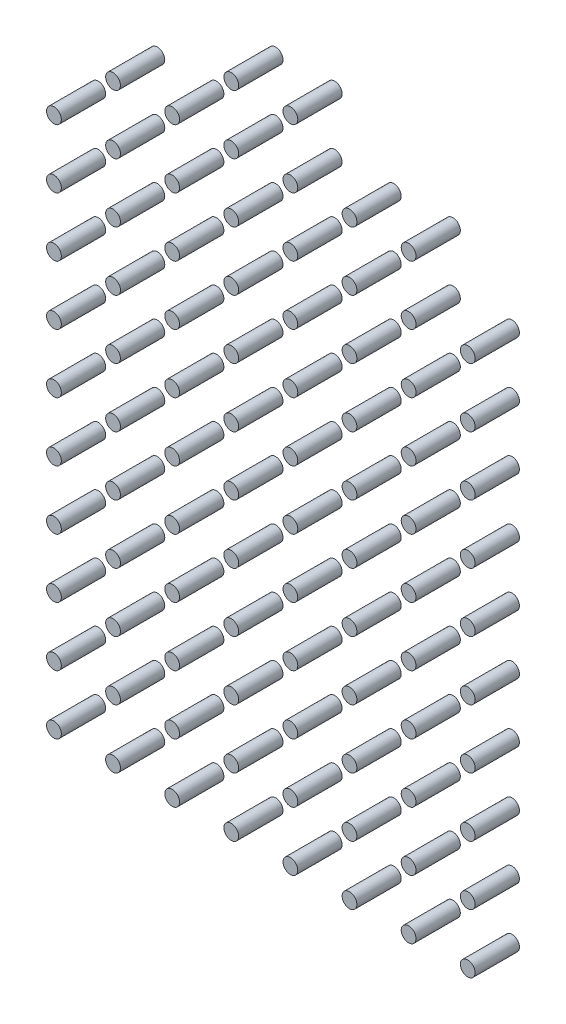
from build123d import *

# Parameters (mm, degrees)
SKETCH_2_R               = 0.25
EXTRUDE_2_DEPTH          = 1.5
PATTERN_LINEAR_1_COUNT   = 8
PATTERN_LINEAR_1_PITCH   = 2
PATTERN_LINEAR_1_2_COUNT = 8
PATTERN_LINEAR_1_2_PITCH = 2


with BuildPart() as part:
    # 草图2 → 凸台-拉伸2 (new body)
    with BuildSketch(Plane.XY):
        with Locations((-9.975090359, 7.0637984)):
            Circle(SKETCH_2_R)
    extrude(amount=EXTRUDE_2_DEPTH)


with BuildPart() as pattern_linear_1_1:
    # 阵列(线性)1: pattern copy
    add(part.part.moved(Location(Vector(1, 0, 0) * (1 * PATTERN_LINEAR_1_PITCH))))


with BuildPart() as pattern_linear_1_2:
    # 阵列(线性)1: pattern copy
    add(part.part.moved(Location(Vector(1, 0, 0) * (2 * PATTERN_LINEAR_1_PITCH))))


with BuildPart() as pattern_linear_1_3:
    # 阵列(线性)1: pattern copy
    add(part.part.moved(Location(Vector(1, 0, 0) * (3 * PATTERN_LINEAR_1_PITCH))))


with BuildPart() as pattern_linear_1_4:
    # 阵列(线性)1: pattern copy
    add(part.part.moved(Location(Vector(1, 0, 0) * (4 * PATTERN_LINEAR_1_PITCH))))


with BuildPart() as pattern_linear_1_5:
    # 阵列(线性)1: pattern copy
    add(part.part.moved(Location(Vector(1, 0, 0) * (5 * PATTERN_LINEAR_1_PITCH))))


with BuildPart() as pattern_linear_1_6:
    # 阵列(线性)1: pattern copy
    add(part.part.moved(Location(Vector(1, 0, 0) * (6 * PATTERN_LINEAR_1_PITCH))))


with BuildPart() as pattern_linear_1_7:
    # 阵列(线性)1: pattern copy
    add(part.part.moved(Location(Vector(1, 0, 0) * (7 * PATTERN_LINEAR_1_PITCH))))


with BuildPart() as pattern_linear_1_2_1:
    # Pattern Linear 1 2: pattern copy
    add(part.part.moved(Location(Vector(0, -1, 0) * (1 * PATTERN_LINEAR_1_2_PITCH))))


with BuildPart() as pattern_linear_1_2_2:
    # Pattern Linear 1 2: pattern copy
    add(part.part.moved(Location(Vector(0, -1, 0) * (2 * PATTERN_LINEAR_1_2_PITCH))))


with BuildPart() as pattern_linear_1_2_3:
    # Pattern Linear 1 2: pattern copy
    add(part.part.moved(Location(Vector(0, -1, 0) * (3 * PATTERN_LINEAR_1_2_PITCH))))


with BuildPart() as pattern_linear_1_2_4:
    # Pattern Linear 1 2: pattern copy
    add(part.part.moved(Location(Vector(0, -1, 0) * (4 * PATTERN_LINEAR_1_2_PITCH))))


with BuildPart() as pattern_linear_1_2_5:
    # Pattern Linear 1 2: pattern copy
    add(part.part.moved(Location(Vector(0, -1, 0) * (5 * PATTERN_LINEAR_1_2_PITCH))))


with BuildPart() as pattern_linear_1_2_6:
    # Pattern Linear 1 2: pattern copy
    add(part.part.moved(Location(Vector(0, -1, 0) * (6 * PATTERN_LINEAR_1_2_PITCH))))


with BuildPart() as pattern_linear_1_2_7:
    # Pattern Linear 1 2: pattern copy
    add(part.part.moved(Location(Vector(0, -1, 0) * (7 * PATTERN_LINEAR_1_2_PITCH))))


with BuildPart() as pattern_linear_1_2_8:
    # Pattern Linear 1 2: pattern copy
    add(pattern_linear_1_1.part.moved(Location(Vector(0, -1, 0) * (1 * PATTERN_LINEAR_1_2_PITCH))))


with BuildPart() as pattern_linear_1_2_9:
    # Pattern Linear 1 2: pattern copy
    add(pattern_linear_1_1.part.moved(Location(Vector(0, -1, 0) * (2 * PATTERN_LINEAR_1_2_PITCH))))


with BuildPart() as pattern_linear_1_2_10:
    # Pattern Linear 1 2: pattern copy
    add(pattern_linear_1_1.part.moved(Location(Vector(0, -1, 0) * (3 * PATTERN_LINEAR_1_2_PITCH))))


with BuildPart() as pattern_linear_1_2_11:
    # Pattern Linear 1 2: pattern copy
    add(pattern_linear_1_1.part.moved(Location(Vector(0, -1, 0) * (4 * PATTERN_LINEAR_1_2_PITCH))))


with BuildPart() as pattern_linear_1_2_12:
    # Pattern Linear 1 2: pattern copy
    add(pattern_linear_1_1.part.moved(Location(Vector(0, -1, 0) * (5 * PATTERN_LINEAR_1_2_PITCH))))


with BuildPart() as pattern_linear_1_2_13:
    # Pattern Linear 1 2: pattern copy
    add(pattern_linear_1_1.part.moved(Location(Vector(0, -1, 0) * (6 * PATTERN_LINEAR_1_2_PITCH))))


with BuildPart() as pattern_linear_1_2_14:
    # Pattern Linear 1 2: pattern copy
    add(pattern_linear_1_1.part.moved(Location(Vector(0, -1, 0) * (7 * PATTERN_LINEAR_1_2_PITCH))))


with BuildPart() as pattern_linear_1_2_15:
    # Pattern Linear 1 2: pattern copy
    add(pattern_linear_1_2.part.moved(Location(Vector(0, -1, 0) * (1 * PATTERN_LINEAR_1_2_PITCH))))


with BuildPart() as pattern_linear_1_2_16:
    # Pattern Linear 1 2: pattern copy
    add(pattern_linear_1_2.part.moved(Location(Vector(0, -1, 0) * (2 * PATTERN_LINEAR_1_2_PITCH))))


with BuildPart() as pattern_linear_1_2_17:
    # Pattern Linear 1 2: pattern copy
    add(pattern_linear_1_2.part.moved(Location(Vector(0, -1, 0) * (3 * PATTERN_LINEAR_1_2_PITCH))))


with BuildPart() as pattern_linear_1_2_18:
    # Pattern Linear 1 2: pattern copy
    add(pattern_linear_1_2.part.moved(Location(Vector(0, -1, 0) * (4 * PATTERN_LINEAR_1_2_PITCH))))


with BuildPart() as pattern_linear_1_2_19:
    # Pattern Linear 1 2: pattern copy
    add(pattern_linear_1_2.part.moved(Location(Vector(0, -1, 0) * (5 * PATTERN_LINEAR_1_2_PITCH))))


with BuildPart() as pattern_linear_1_2_20:
    # Pattern Linear 1 2: pattern copy
    add(pattern_linear_1_2.part.moved(Location(Vector(0, -1, 0) * (6 * PATTERN_LINEAR_1_2_PITCH))))


with BuildPart() as pattern_linear_1_2_21:
    # Pattern Linear 1 2: pattern copy
    add(pattern_linear_1_2.part.moved(Location(Vector(0, -1, 0) * (7 * PATTERN_LINEAR_1_2_PITCH))))


with BuildPart() as pattern_linear_1_2_22:
    # Pattern Linear 1 2: pattern copy
    add(pattern_linear_1_3.part.moved(Location(Vector(0, -1, 0) * (1 * PATTERN_LINEAR_1_2_PITCH))))


with BuildPart() as pattern_linear_1_2_23:
    # Pattern Linear 1 2: pattern copy
    add(pattern_linear_1_3.part.moved(Location(Vector(0, -1, 0) * (2 * PATTERN_LINEAR_1_2_PITCH))))


with BuildPart() as pattern_linear_1_2_24:
    # Pattern Linear 1 2: pattern copy
    add(pattern_linear_1_3.part.moved(Location(Vector(0, -1, 0) * (3 * PATTERN_LINEAR_1_2_PITCH))))


with BuildPart() as pattern_linear_1_2_25:
    # Pattern Linear 1 2: pattern copy
    add(pattern_linear_1_3.part.moved(Location(Vector(0, -1, 0) * (4 * PATTERN_LINEAR_1_2_PITCH))))


with BuildPart() as pattern_linear_1_2_26:
    # Pattern Linear 1 2: pattern copy
    add(pattern_linear_1_3.part.moved(Location(Vector(0, -1, 0) * (5 * PATTERN_LINEAR_1_2_PITCH))))


with BuildPart() as pattern_linear_1_2_27:
    # Pattern Linear 1 2: pattern copy
    add(pattern_linear_1_3.part.moved(Location(Vector(0, -1, 0) * (6 * PATTERN_LINEAR_1_2_PITCH))))


with BuildPart() as pattern_linear_1_2_28:
    # Pattern Linear 1 2: pattern copy
    add(pattern_linear_1_3.part.moved(Location(Vector(0, -1, 0) * (7 * PATTERN_LINEAR_1_2_PITCH))))


with BuildPart() as pattern_linear_1_2_29:
    # Pattern Linear 1 2: pattern copy
    add(pattern_linear_1_4.part.moved(Location(Vector(0, -1, 0) * (1 * PATTERN_LINEAR_1_2_PITCH))))


with BuildPart() as pattern_linear_1_2_30:
    # Pattern Linear 1 2: pattern copy
    add(pattern_linear_1_4.part.moved(Location(Vector(0, -1, 0) * (2 * PATTERN_LINEAR_1_2_PITCH))))


with BuildPart() as pattern_linear_1_2_31:
    # Pattern Linear 1 2: pattern copy
    add(pattern_linear_1_4.part.moved(Location(Vector(0, -1, 0) * (3 * PATTERN_LINEAR_1_2_PITCH))))


with BuildPart() as pattern_linear_1_2_32:
    # Pattern Linear 1 2: pattern copy
    add(pattern_linear_1_4.part.moved(Location(Vector(0, -1, 0) * (4 * PATTERN_LINEAR_1_2_PITCH))))


with BuildPart() as pattern_linear_1_2_33:
    # Pattern Linear 1 2: pattern copy
    add(pattern_linear_1_4.part.moved(Location(Vector(0, -1, 0) * (5 * PATTERN_LINEAR_1_2_PITCH))))


with BuildPart() as pattern_linear_1_2_34:
    # Pattern Linear 1 2: pattern copy
    add(pattern_linear_1_4.part.moved(Location(Vector(0, -1, 0) * (6 * PATTERN_LINEAR_1_2_PITCH))))


with BuildPart() as pattern_linear_1_2_35:
    # Pattern Linear 1 2: pattern copy
    add(pattern_linear_1_4.part.moved(Location(Vector(0, -1, 0) * (7 * PATTERN_LINEAR_1_2_PITCH))))


with BuildPart() as pattern_linear_1_2_36:
    # Pattern Linear 1 2: pattern copy
    add(pattern_linear_1_5.part.moved(Location(Vector(0, -1, 0) * (1 * PATTERN_LINEAR_1_2_PITCH))))


with BuildPart() as pattern_linear_1_2_37:
    # Pattern Linear 1 2: pattern copy
    add(pattern_linear_1_5.part.moved(Location(Vector(0, -1, 0) * (2 * PATTERN_LINEAR_1_2_PITCH))))


with BuildPart() as pattern_linear_1_2_38:
    # Pattern Linear 1 2: pattern copy
    add(pattern_linear_1_5.part.moved(Location(Vector(0, -1, 0) * (3 * PATTERN_LINEAR_1_2_PITCH))))


with BuildPart() as pattern_linear_1_2_39:
    # Pattern Linear 1 2: pattern copy
    add(pattern_linear_1_5.part.moved(Location(Vector(0, -1, 0) * (4 * PATTERN_LINEAR_1_2_PITCH))))


with BuildPart() as pattern_linear_1_2_40:
    # Pattern Linear 1 2: pattern copy
    add(pattern_linear_1_5.part.moved(Location(Vector(0, -1, 0) * (5 * PATTERN_LINEAR_1_2_PITCH))))


with BuildPart() as pattern_linear_1_2_41:
    # Pattern Linear 1 2: pattern copy
    add(pattern_linear_1_5.part.moved(Location(Vector(0, -1, 0) * (6 * PATTERN_LINEAR_1_2_PITCH))))


with BuildPart() as pattern_linear_1_2_42:
    # Pattern Linear 1 2: pattern copy
    add(pattern_linear_1_5.part.moved(Location(Vector(0, -1, 0) * (7 * PATTERN_LINEAR_1_2_PITCH))))


with BuildPart() as pattern_linear_1_2_43:
    # Pattern Linear 1 2: pattern copy
    add(pattern_linear_1_6.part.moved(Location(Vector(0, -1, 0) * (1 * PATTERN_LINEAR_1_2_PITCH))))


with BuildPart() as pattern_linear_1_2_44:
    # Pattern Linear 1 2: pattern copy
    add(pattern_linear_1_6.part.moved(Location(Vector(0, -1, 0) * (2 * PATTERN_LINEAR_1_2_PITCH))))


with BuildPart() as pattern_linear_1_2_45:
    # Pattern Linear 1 2: pattern copy
    add(pattern_linear_1_6.part.moved(Location(Vector(0, -1, 0) * (3 * PATTERN_LINEAR_1_2_PITCH))))


with BuildPart() as pattern_linear_1_2_46:
    # Pattern Linear 1 2: pattern copy
    add(pattern_linear_1_6.part.moved(Location(Vector(0, -1, 0) * (4 * PATTERN_LINEAR_1_2_PITCH))))


with BuildPart() as pattern_linear_1_2_47:
    # Pattern Linear 1 2: pattern copy
    add(pattern_linear_1_6.part.moved(Location(Vector(0, -1, 0) * (5 * PATTERN_LINEAR_1_2_PITCH))))


with BuildPart() as pattern_linear_1_2_48:
    # Pattern Linear 1 2: pattern copy
    add(pattern_linear_1_6.part.moved(Location(Vector(0, -1, 0) * (6 * PATTERN_LINEAR_1_2_PITCH))))


with BuildPart() as pattern_linear_1_2_49:
    # Pattern Linear 1 2: pattern copy
    add(pattern_linear_1_6.part.moved(Location(Vector(0, -1, 0) * (7 * PATTERN_LINEAR_1_2_PITCH))))


with BuildPart() as pattern_linear_1_2_50:
    # Pattern Linear 1 2: pattern copy
    add(pattern_linear_1_7.part.moved(Location(Vector(0, -1, 0) * (1 * PATTERN_LINEAR_1_2_PITCH))))


with BuildPart() as pattern_linear_1_2_51:
    # Pattern Linear 1 2: pattern copy
    add(pattern_linear_1_7.part.moved(Location(Vector(0, -1, 0) * (2 * PATTERN_LINEAR_1_2_PITCH))))


with BuildPart() as pattern_linear_1_2_52:
    # Pattern Linear 1 2: pattern copy
    add(pattern_linear_1_7.part.moved(Location(Vector(0, -1, 0) * (3 * PATTERN_LINEAR_1_2_PITCH))))


with BuildPart() as pattern_linear_1_2_53:
    # Pattern Linear 1 2: pattern copy
    add(pattern_linear_1_7.part.moved(Location(Vector(0, -1, 0) * (4 * PATTERN_LINEAR_1_2_PITCH))))


with BuildPart() as pattern_linear_1_2_54:
    # Pattern Linear 1 2: pattern copy
    add(pattern_linear_1_7.part.moved(Location(Vector(0, -1, 0) * (5 * PATTERN_LINEAR_1_2_PITCH))))


with BuildPart() as pattern_linear_1_2_55:
    # Pattern Linear 1 2: pattern copy
    add(pattern_linear_1_7.part.moved(Location(Vector(0, -1, 0) * (6 * PATTERN_LINEAR_1_2_PITCH))))


with BuildPart() as pattern_linear_1_2_56:
    # Pattern Linear 1 2: pattern copy
    add(pattern_linear_1_7.part.moved(Location(Vector(0, -1, 0) * (7 * PATTERN_LINEAR_1_2_PITCH))))


with BuildPart() as body_65:
    # 填充阵列1: read off the stored shape, not the designer's step
    # 填充阵列1: copy of 阵列(线性)1 2_56
    add(pattern_linear_1_2_56.part.moved(Location((0, 16, 0))))


with BuildPart() as body_66:
    # Other 1 2: copy of 阵列(线性)1 2_56
    add(pattern_linear_1_2_56.part.moved(Location((0, 18, 0))))


with BuildPart() as body_67:
    # Other 1 3: copy of 阵列(线性)1 2_56
    add(pattern_linear_1_2_56.part.moved(Location((-2, 16, 0))))


with BuildPart() as body_68:
    # Other 1 4: copy of 阵列(线性)1 2_56
    add(pattern_linear_1_2_56.part.moved(Location((-2, 18, 0))))


with BuildPart() as body_69:
    # Other 1 5: copy of 阵列(线性)1 2_56
    add(pattern_linear_1_2_56.part.moved(Location((-2, 20, 0))))


with BuildPart() as body_70:
    # Other 1 6: copy of 阵列(线性)1 2_56
    add(pattern_linear_1_2_56.part.moved(Location((-4, 16, 0))))


with BuildPart() as body_71:
    # Other 1 7: copy of 阵列(线性)1 2_56
    add(pattern_linear_1_2_56.part.moved(Location((-4, 18, 0))))


with BuildPart() as body_72:
    # Other 1 8: copy of 阵列(线性)1 2_56
    add(pattern_linear_1_2_56.part.moved(Location((-4, 20, 0))))


with BuildPart() as body_73:
    # Other 1 9: copy of 阵列(线性)1 2_56
    add(pattern_linear_1_2_56.part.moved(Location((-8, 22, 0))))


with BuildPart() as body_74:
    # Other 1 10: copy of 阵列(线性)1 2_56
    add(pattern_linear_1_2_56.part.moved(Location((-6, 16, 0))))


with BuildPart() as body_75:
    # Other 1 11: copy of 阵列(线性)1 2_56
    add(pattern_linear_1_2_56.part.moved(Location((-6, 18, 0))))


with BuildPart() as body_76:
    # Other 1 12: copy of 阵列(线性)1 2_56
    add(pattern_linear_1_2_56.part.moved(Location((-6, 20, 0))))


with BuildPart() as body_77:
    # Other 1 13: copy of 阵列(线性)1 2_56
    add(pattern_linear_1_2_56.part.moved(Location((-6, 22, 0))))


with BuildPart() as body_78:
    # Other 1 14: copy of 阵列(线性)1 2_56
    add(pattern_linear_1_2_56.part.moved(Location((-10, 20, 0))))


with BuildPart() as body_79:
    # Other 1 15: copy of 阵列(线性)1 2_56
    add(pattern_linear_1_2_56.part.moved(Location((-12, 20, 0))))


with BuildPart() as body_80:
    # Other 1 16: copy of 阵列(线性)1 2_56
    add(pattern_linear_1_2_56.part.moved(Location((-8, 16, 0))))


with BuildPart() as body_81:
    # Other 1 17: copy of 阵列(线性)1 2_56
    add(pattern_linear_1_2_56.part.moved(Location((-8, 18, 0))))


with BuildPart() as body_82:
    # Other 1 18: copy of 阵列(线性)1 2_56
    add(pattern_linear_1_2_56.part.moved(Location((-8, 20, 0))))


with BuildPart() as body_83:
    # Other 1 19: copy of 阵列(线性)1 2_56
    add(pattern_linear_1_2_56.part.moved(Location((-12, 18, 0))))


with BuildPart() as body_84:
    # Other 1 20: copy of 阵列(线性)1 2_56
    add(pattern_linear_1_2_56.part.moved(Location((-14, 18, 0))))


with BuildPart() as body_85:
    # Other 1 21: copy of 阵列(线性)1 2_56
    add(pattern_linear_1_2_56.part.moved(Location((-10, 16, 0))))


with BuildPart() as body_86:
    # Other 1 22: copy of 阵列(线性)1 2_56
    add(pattern_linear_1_2_56.part.moved(Location((-10, 18, 0))))


with BuildPart() as body_87:
    # Other 1 23: copy of 阵列(线性)1 2_56
    add(pattern_linear_1_2_56.part.moved(Location((-14, 16, 0))))


with BuildPart() as body_88:
    # Other 1 24: copy of 阵列(线性)1 2_56
    add(pattern_linear_1_2_56.part.moved(Location((-12, 16, 0))))


with BuildPart() as body_89:
    # Other 1 25: copy of 阵列(线性)1 2_56
    add(pattern_linear_1_2_56.part.moved(Location((-4, 22, 0))))


with BuildPart() as body_90:
    # Other 1 26: copy of 阵列(线性)1 2_56
    add(pattern_linear_1_2_56.part.moved(Location((-10, 22, 0))))


solid = Compound([part.part, pattern_linear_1_1.part, pattern_linear_1_2.part, pattern_linear_1_3.part, pattern_linear_1_4.part, pattern_linear_1_5.part, pattern_linear_1_6.part, pattern_linear_1_7.part, pattern_linear_1_2_1.part, pattern_linear_1_2_2.part, pattern_linear_1_2_3.part, pattern_linear_1_2_4.part, pattern_linear_1_2_5.part, pattern_linear_1_2_6.part, pattern_linear_1_2_7.part, pattern_linear_1_2_8.part, pattern_linear_1_2_9.part, pattern_linear_1_2_10.part, pattern_linear_1_2_11.part, pattern_linear_1_2_12.part, pattern_linear_1_2_13.part, pattern_linear_1_2_14.part, pattern_linear_1_2_15.part, pattern_linear_1_2_16.part, pattern_linear_1_2_17.part, pattern_linear_1_2_18.part, pattern_linear_1_2_19.part, pattern_linear_1_2_20.part, pattern_linear_1_2_21.part, pattern_linear_1_2_22.part, pattern_linear_1_2_23.part, pattern_linear_1_2_24.part, pattern_linear_1_2_25.part, pattern_linear_1_2_26.part, pattern_linear_1_2_27.part, pattern_linear_1_2_28.part, pattern_linear_1_2_29.part, pattern_linear_1_2_30.part, pattern_linear_1_2_31.part, pattern_linear_1_2_32.part, pattern_linear_1_2_33.part, pattern_linear_1_2_34.part, pattern_linear_1_2_35.part, pattern_linear_1_2_36.part, pattern_linear_1_2_37.part, pattern_linear_1_2_38.part, pattern_linear_1_2_39.part, pattern_linear_1_2_40.part, pattern_linear_1_2_41.part, pattern_linear_1_2_42.part, pattern_linear_1_2_43.part, pattern_linear_1_2_44.part, pattern_linear_1_2_45.part, pattern_linear_1_2_46.part, pattern_linear_1_2_47.part, pattern_linear_1_2_48.part, pattern_linear_1_2_49.part, pattern_linear_1_2_50.part, pattern_linear_1_2_51.part, pattern_linear_1_2_52.part, pattern_linear_1_2_53.part, pattern_linear_1_2_54.part, pattern_linear_1_2_55.part, pattern_linear_1_2_56.part, body_65.part, body_66.part, body_67.part, body_68.part, body_69.part, body_70.part, body_71.part, body_72.part, body_73.part, body_74.part, body_75.part, body_76.part, body_77.part, body_78.part, body_79.part, body_80.part, body_81.part, body_82.part, body_83.part, body_84.part, body_85.part, body_86.part, body_87.part, body_88.part])
